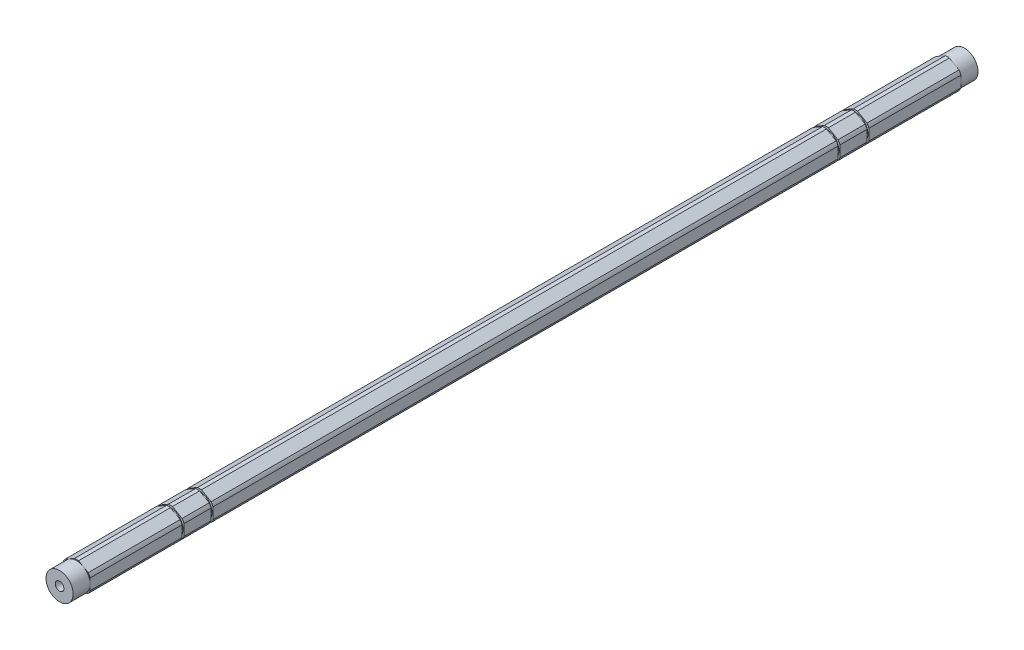
from build123d import *

# Parameters (mm, degrees)
BOSS_EXTRUDE1_DEPTH                  = 203.2
SKETCH6_R                            = 6.35
BOSS_EXTRUDE2_DEPTH                  = 7.9375
F_10_32_TAPPED_HOLE1_D               = 4.0386
F_10_32_TAPPED_HOLE1_DEPTH           = 16.34744
F_10_32_TAPPED_HOLE1_TIP             = 1.213317848
F_10_32_TAPPED_HOLE1_ON_FACE_2_D     = 4.0386
F_10_32_TAPPED_HOLE1_ON_FACE_2_DEPTH = 16.34744
F_10_32_TAPPED_HOLE1_ON_FACE_2_TIP   = 1.213317848
SKETCH5_W                            = 0.889
SKETCH5_H                            = 1.0033


with BuildPart() as part:
    # Sketch1 → Boss-Extrude1 (new, symmetric)
    with BuildSketch(Plane.XY):
        with BuildLine():
            ThreePointArc((0.93173274, 6.79441227), (0, 6.858), (-0.93173274, 6.79441227))
            Line((-0.93173274, 6.79441227), (-5.41826726, 4.204110358))
            ThreePointArc((-5.41826726, 4.204110358), (-5.939202219, 3.429), (-6.35, 2.590301913))
            Line((-6.35, 2.590301913), (-6.35, -2.590301913))
            ThreePointArc((-6.35, -2.590301913), (-5.939202219, -3.429), (-5.41826726, -4.204110358))
            Line((-5.41826726, -4.204110358), (-0.93173274, -6.79441227))
            ThreePointArc((-0.93173274, -6.79441227), (0, -6.858), (0.93173274, -6.79441227))
            Line((0.93173274, -6.79441227), (5.41826726, -4.204110358))
            ThreePointArc((5.41826726, -4.204110358), (5.939202219, -3.429), (6.35, -2.590301913))
            Line((6.35, -2.590301913), (6.35, 2.590301913))
            ThreePointArc((6.35, 2.590301913), (5.939202219, 3.429), (5.41826726, 4.204110358))
            Line((5.41826726, 4.204110358), (0.93173274, 6.79441227))
        make_face()
    extrude(amount=BOSS_EXTRUDE1_DEPTH, both=True)

    # Sketch6 → Boss-Extrude2 (add)
    with BuildSketch(Plane.XY.offset(203.2)):
        Circle(SKETCH6_R)
    boss_extrude2 = extrude(amount=BOSS_EXTRUDE2_DEPTH)

    # Mirror2: Boss-Extrude2 across plane
    add(boss_extrude2.mirror(Plane.XY))

    # #10-32 Tapped Hole1
    with Locations(Plane.XY.offset(211.1375)):
        with Locations((0, 0)):
            Hole(F_10_32_TAPPED_HOLE1_D / 2, depth=F_10_32_TAPPED_HOLE1_DEPTH)
            with Locations((0, 0, -(F_10_32_TAPPED_HOLE1_DEPTH + F_10_32_TAPPED_HOLE1_TIP / 2))):  # 118° drill point
                Cone(0, F_10_32_TAPPED_HOLE1_D / 2, F_10_32_TAPPED_HOLE1_TIP, mode=Mode.SUBTRACT)

    # #10-32 Tapped Hole1 on face 2
    with Locations(Plane(origin=(0, 0, -211.1375), x_dir=(-1, 0, 0), z_dir=(0, 0, -1))):
        with Locations((0, 0)):
            Hole(F_10_32_TAPPED_HOLE1_ON_FACE_2_D / 2, depth=F_10_32_TAPPED_HOLE1_ON_FACE_2_DEPTH)
            with Locations((0, 0, -(F_10_32_TAPPED_HOLE1_ON_FACE_2_DEPTH + F_10_32_TAPPED_HOLE1_ON_FACE_2_TIP / 2))):  # 118° drill point
                Cone(0, F_10_32_TAPPED_HOLE1_ON_FACE_2_D / 2, F_10_32_TAPPED_HOLE1_ON_FACE_2_TIP, mode=Mode.SUBTRACT)

    # Sketch5 → Cut-Revolve1 (revolve, cut)
    with BuildSketch(Plane(origin=(0, 0, 0), x_dir=(0, 0, -1), z_dir=(1, 0, 0))):
        with Locations((-159.82823, 6.35635)):
            Rectangle(SKETCH5_W, SKETCH5_H)
        with Locations((-146.30273, 6.35635)):
            Rectangle(SKETCH5_W, SKETCH5_H)
    cut_revolve1 = revolve(axis=Axis((0, 0, 165.047176272), (0, 0, -1)), mode=Mode.SUBTRACT)

    # Mirror1: Cut-Revolve1 across plane
    add(cut_revolve1.mirror(Plane.XY), mode=Mode.SUBTRACT)


solid = part.part
